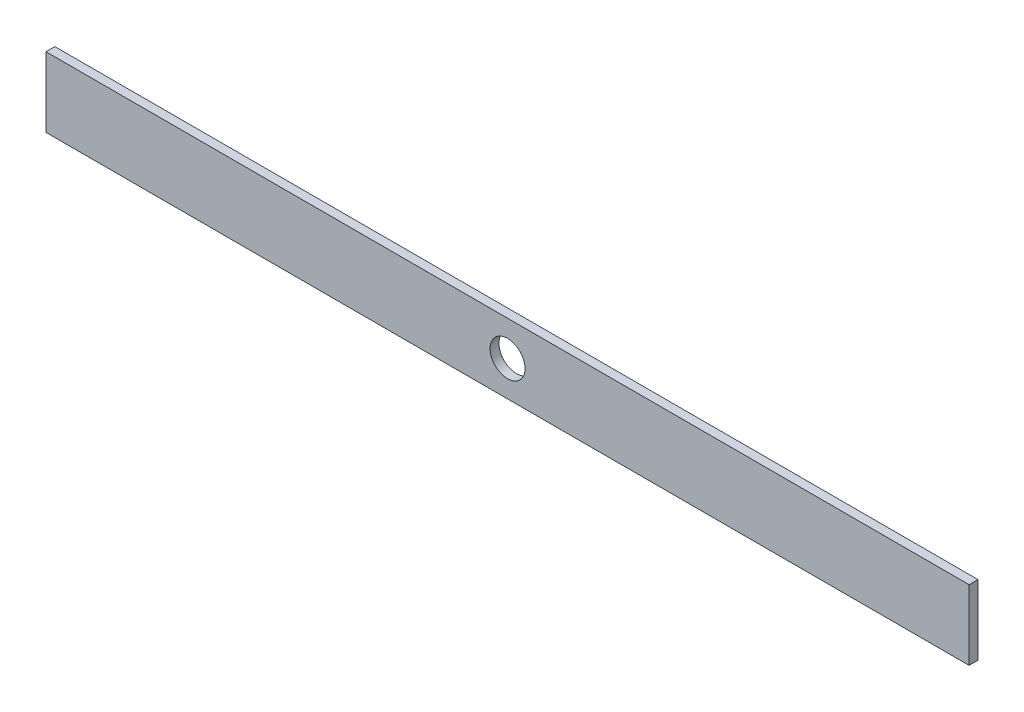
from build123d import *

# Parameters (mm, degrees)
SKETCH1_W           = 660.4
SKETCH1_H           = 50
BOSS_EXTRUDE1_DEPTH = 6.35
SKETCH2_R           = 12.5
CUT_EXTRUDE1_DEPTH  = 332.205921596


with BuildPart() as part:
    # Sketch1 → Boss-Extrude1 (new body)
    with BuildSketch(Plane.XY):
        Rectangle(SKETCH1_W, SKETCH1_H)
    extrude(amount=BOSS_EXTRUDE1_DEPTH)

    # Sketch2 → Cut-Extrude1 (cut, through all)
    with BuildSketch(Plane(origin=(0, 0, 0), x_dir=(-1, 0, 0), z_dir=(0, 0, -1))):
        Circle(SKETCH2_R)
    extrude(amount=-CUT_EXTRUDE1_DEPTH, mode=Mode.SUBTRACT)


solid = part.part
